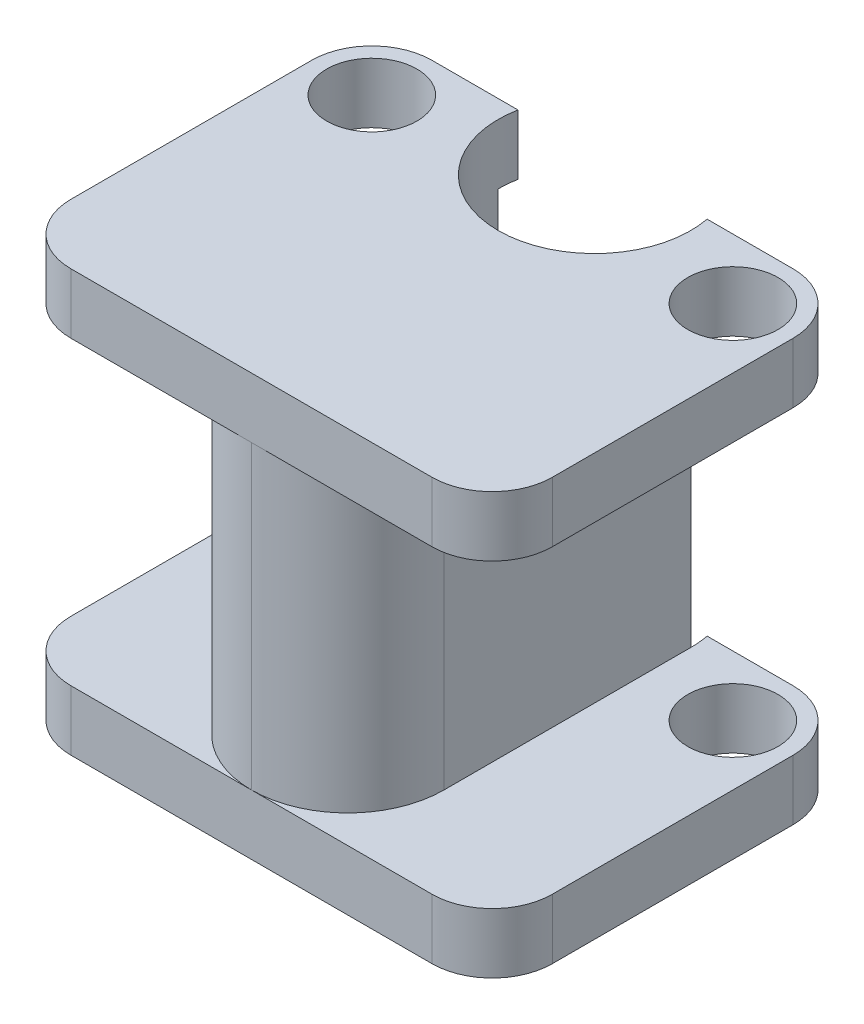
from build123d import *
from build123d.topology import SkipClean

# Parameters (mm, degrees)
BOSS_EXTRUDE1_DEPTH = 10
BOSS_EXTRUDE2_DEPTH = 2
FILLET1_R           = 3.2
BOSS_EXTRUDE4_START = 2
BOSS_EXTRUDE4_DEPTH = 2
FILLET3_R           = 2
SKETCH5_R           = 1.5
CUT_EXTRUDE1_DEPTH  = 14


with BuildPart() as part:
    # Sketch1 → Boss-Extrude1 (new body)
    with BuildSketch(Plane(origin=(0, 0, 0), x_dir=(1, 0, 0), z_dir=(0, 1, 0))):
        with BuildLine():
            Line((-3.2, 7.4), (-3.2, 4))
            Line((-3.2, 4), (-3.2, -4))
            Line((-3.2, -4), (3.2, -4))
            Line((3.2, -4), (3.2, 4))
            Line((3.2, 4), (3.2, 7.4))
            ThreePointArc((3.2, 7.4), (0, 4.2), (-3.2, 7.4))
        make_face()
    extrude(amount=BOSS_EXTRUDE1_DEPTH)

    # Sketch2 → Boss-Extrude2 (add)
    with SkipClean():  # the faces are left unmerged after this step: merging them gives an invalid solid
        with BuildSketch(Plane(origin=(0, 10, 0), x_dir=(1, 0, 0), z_dir=(0, 1, 0))):
            with BuildLine():
                Line((-8, 8), (-3.143246729, 8))
                ThreePointArc((-3.143246729, 8), (0, 4.2), (3.143246729, 8))
                Line((3.143246729, 8), (8, 8))
                Line((8, 8), (8, -4))
                Line((8, -4), (-8, -4))
                Line((-8, -4), (-8, 8))
            make_face()
        extrude(amount=BOSS_EXTRUDE2_DEPTH)

    # Fillet1
    # the kernel refuses this fillet: 3.2 mm, written as the material it takes off along each edge
    with BuildSketch(Plane(origin=(-3.2, -8, 4), x_dir=(0, 0, -1), z_dir=(0, 1, 0)), Plane(origin=(3.2, -8, 4), x_dir=(-1, 0, 0), z_dir=(0, 1, 0))) as fillet1_piece_1:
        with BuildLine():
            CenterArc((FILLET1_R, -FILLET1_R), FILLET1_R, 90, 90)
            Line((0, -FILLET1_R), (0, 0))
            Line((0, 0), (FILLET1_R, 0))
        make_face()
    extrude(amount=18, mode=Mode.SUBTRACT)

    # Sketch3 → Boss-Extrude4 (add)
    with SkipClean():  # the faces are left unmerged after this step: merging them gives an invalid solid
        with BuildSketch(Plane.XZ.offset(BOSS_EXTRUDE4_START)):
            with BuildLine():
                Line((8, 4), (-8, 4))
                Line((-8, 4), (-8, -8))
                Line((-8, -8), (-3.143246729, -8))
                ThreePointArc((-3.143246729, -8), (0, -4.2), (3.143246729, -8))
                Line((3.143246729, -8), (8, -8))
                Line((8, -8), (8, 4))
            make_face()
        extrude(amount=-BOSS_EXTRUDE4_DEPTH)

    # Fillet3
    fillet3_edges = [part.edges().sort_by_distance(p)[0] for p in [
        (-8, 11, -8),
        (-8, 11, 4),
        (8, 11, 4),
        (8, 11, -8),
        (8, -1, -8),
        (8, -1, 4),
        (-8, -1, 4),
        (-8, -1, -8),
    ]]
    fillet(fillet3_edges, radius=FILLET3_R)

    # Sketch5 → Cut-Extrude1 (cut)
    with SkipClean():  # the faces are left unmerged after this step: merging them gives an invalid solid
        with BuildSketch(Plane(origin=(0, 12, 0), x_dir=(1, 0, 0), z_dir=(0, 1, 0))):
            with Locations(Location((-6, 6, 0), (0, 0, 270))):
                Circle(SKETCH5_R)
            with Locations(Location((6, 6, 0), (0, 0, 270))):
                Circle(SKETCH5_R)
        extrude(amount=-CUT_EXTRUDE1_DEPTH, mode=Mode.SUBTRACT)


solid = part.part
